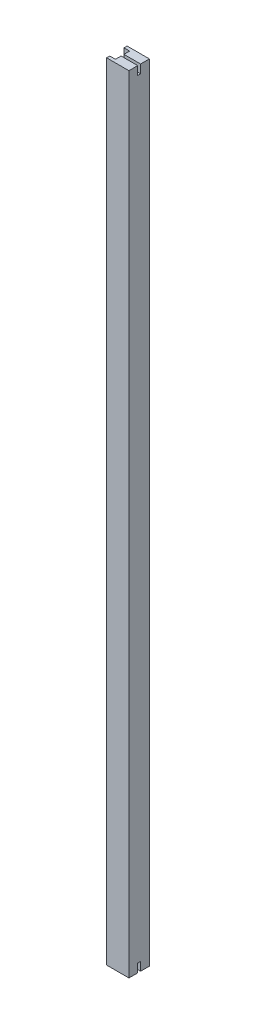
from build123d import *

# Parameters (mm, degrees)
EXTRUDE_1_DEPTH     = 1383.55
SKETCH_3_W          = 5
SKETCH_3_H          = 15
CUT_EXTRUDE_4_DEPTH = 1385.22381635


with BuildPart() as part:
    # Эскиз1 → Бобышка-Вытянуть1 (new body)
    with BuildSketch(Plane(origin=(0, 0, 0), x_dir=(1, 0, 0), z_dir=(0, 1, 0))):
        Polygon((10, 2.5), (10, 12.5), (0, 12.5), (0, 18), (39.25520667, 18), (39.25520667, -18), (0, -18), (0, -12.5), (10, -12.5), (10, -2.5), (0, -2.5), (0, 2.5), align=None)
    extrude(amount=EXTRUDE_1_DEPTH)

    # Эскиз3 → Вырез-Вытянуть4 (cut, through all)
    with BuildSketch(Plane(origin=(39.25520667, 0, 0), x_dir=(0, 0, -1), z_dir=(1, 0, 0))):
        with Locations((0, 7.5)):
            Rectangle(SKETCH_3_W, SKETCH_3_H)
        with Locations((0, 1376.05)):
            Rectangle(SKETCH_3_W, SKETCH_3_H)
    extrude(amount=-CUT_EXTRUDE_4_DEPTH, mode=Mode.SUBTRACT)


solid = part.part
